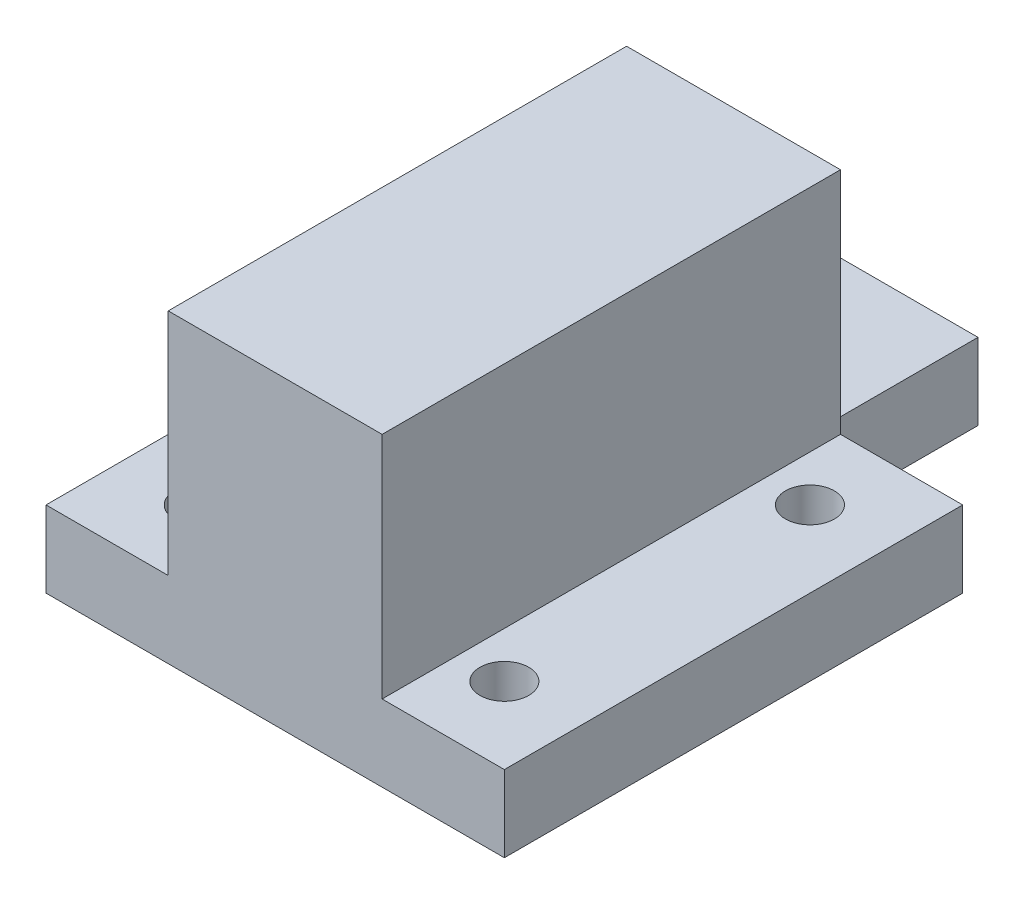
from build123d import *

# Parameters (mm, degrees)
SKETCH1_R           = 1.6
BOSS_EXTRUDE3_DEPTH = 5
SKETCH2_W           = 14
SKETCH2_H           = 30
BOSS_EXTRUDE2_DEPTH = 15


with BuildPart() as part:
    # Sketch1 → Boss-Extrude3 (new body)
    with BuildSketch(Plane(origin=(0, 0, 0), x_dir=(1, 0, 0), z_dir=(0, 1, 0))):
        Polygon((-6, 15), (-15, 15), (-15, -15), (15, -15), (15, 15), (6, 15), (6, 25), (-6, 25), align=None)
        with Locations((-10, -10)):
            Circle(SKETCH1_R, mode=Mode.SUBTRACT)
        with Locations((10, -10)):
            Circle(SKETCH1_R, mode=Mode.SUBTRACT)
        with Locations((-10, 10)):
            Circle(SKETCH1_R, mode=Mode.SUBTRACT)
        with Locations((10, 10)):
            Circle(SKETCH1_R, mode=Mode.SUBTRACT)
    extrude(amount=BOSS_EXTRUDE3_DEPTH)

    # Sketch2 → Boss-Extrude2 (add)
    with BuildSketch(Plane(origin=(0, 5, 0), x_dir=(1, 0, 0), z_dir=(0, 1, 0))):
        Rectangle(SKETCH2_W, SKETCH2_H)
    extrude(amount=BOSS_EXTRUDE2_DEPTH)


solid = part.part
